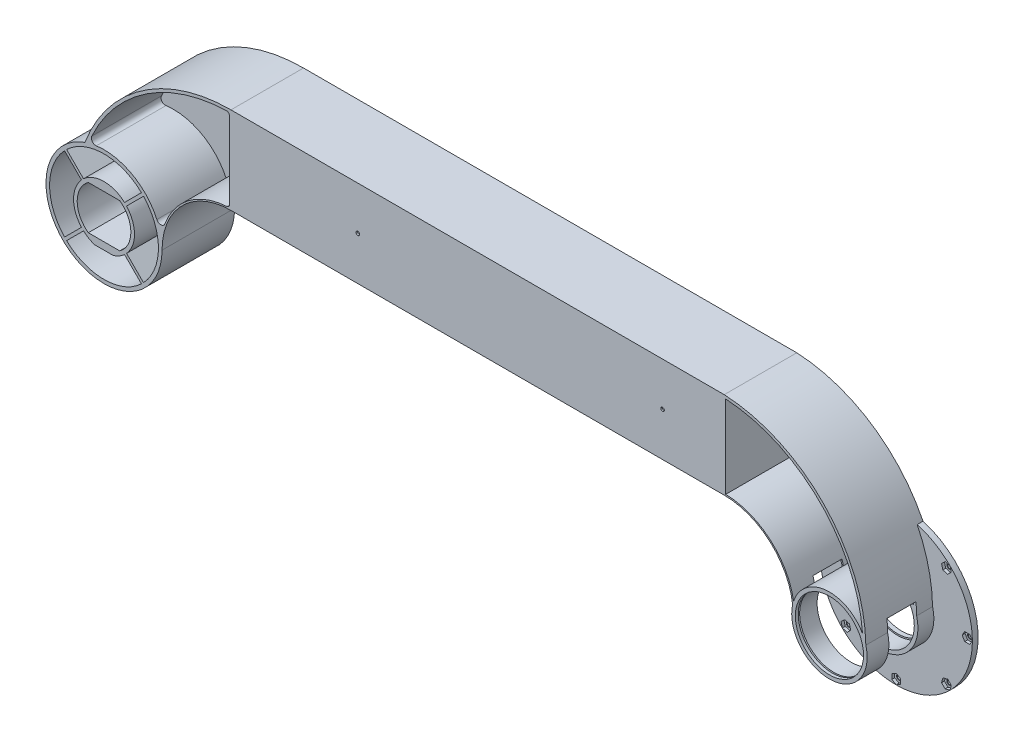
from build123d import *
from build123d.topology import SkipClean

# Parameters (mm, degrees)
BOSS_EXTRUDE1_DEPTH             = 1
BOSS_EXTRUDE2_DEPTH             = 25
SKETCH1_11_R                    = 40
SKETCH1_11_R_2                  = 37.5
SKETCH1_11_R_3                  = 21
BOSS_EXTRUDE3_DEPTH             = 2
SKETCH1_12_R                    = 21
SKETCH1_12_R_2                  = 15
BOSS_EXTRUDE4_DEPTH             = 25
SKETCH1_13_R                    = 40
SKETCH1_13_R_2                  = 37.5
BOSS_EXTRUDE5_DEPTH             = 25
BOSS_EXTRUDE6_START             = -2
SKETCH1_14_R                    = 40
SKETCH1_14_R_2                  = 21
BOSS_EXTRUDE6_DEPTH             = 3
SKETCH1_15_R                    = 23.5
SKETCH1_15_R_2                  = 21
BOSS_EXTRUDE7_DEPTH             = 14
SKETCH1_16_R                    = 40
SKETCH1_16_R_2                  = 23.5
BOSS_EXTRUDE8_DEPTH             = 14
SKETCH1_17_R                    = 37.5
SKETCH1_17_R_2                  = 21
CUT_EXTRUDE1_DEPTH              = 2
SKETCH3_R                       = 31
CUT_EXTRUDE2_DEPTH              = 22
CUT_EXTRUDE4_START              = 1
CUT_EXTRUDE4_DEPTH              = 1
BOSS_EXTRUDE9_START             = 50
BOSS_EXTRUDE9_DEPTH             = 50
BOSS_EXTRUDE10_START            = 50
BOSS_EXTRUDE10_DEPTH            = 50
CUT_EXTRUDE8_DEPTH              = 60
CUT_EXTRUDE8_DEPTH_BACK         = 60
SKETCH6_W                       = 248.929499316
SKETCH6_H                       = 245.601683372
SKETCH7_R                       = 23.5
BOSS_EXTRUDE11_DEPTH            = 50
SKETCH7_23_W                    = 340
SKETCH7_23_H                    = 57
BOSS_EXTRUDE12_DEPTH            = 1
SKETCH10_W                      = 1
SKETCH10_H                      = 57
BOSS_EXTRUDE13_DEPTH            = 15
BOSS_EXTRUDE14_DEPTH            = 2
CUT_EXTRUDE9_START              = 62
CUT_EXTRUDE9_DEPTH              = 62
BOSS_EXTRUDE15_START            = 2
BOSS_EXTRUDE15_DEPTH            = 2
SKETCH7_27_R                    = 37.5
SKETCH7_27_R_2                  = 21
CUT_EXTRUDE10_DEPTH             = 60
SKETCH7_28_R                    = 37.5
SKETCH7_28_R_2                  = 21
BOSS_EXTRUDE16_DEPTH            = 2
FILLET7_R                       = 3
FILLET8_R                       = 2
RIB2_START                      = -48
RIB2_DEPTH                      = 48
SKETCH16_R                      = 5
CUT_EXTRUDE12_DEPTH             = 10
SKETCH17_R                      = 52.5
SKETCH17_R_2                    = 22.5
BOSS_EXTRUDE17_DEPTH            = 4
SKETCH24_R                      = 26
SKETCH24_R_2                    = 23.5
BOSS_EXTRUDE18_DEPTH            = 50
F_3_0MM_DOWEL_HOLE2_D           = 3
F_3_0MM_DOWEL_HOLE2_CSINK_D     = 3.05
F_3_0MM_DOWEL_HOLE2_CSINK_ANGLE = 90
CUT_EXTRUDE13_DEPTH             = 50
CUT_EXTRUDE11_DEPTH             = 15
CUT_EXTRUDE11_DEPTH_BACK        = 40
SKETCH11_W                      = 120
SKETCH11_H                      = 20
SKETCH25_R                      = 25
CUT_EXTRUDE14_DEPTH             = 1
SKETCH30_W                      = 25.987538792
SKETCH30_H                      = 46.839615916
CUT_EXTRUDE17_DEPTH             = 10
CUT_EXTRUDE18_DEPTH             = 2
F_2_5MM_DOWEL_HOLE1_D           = 2.5
F_2_5MM_DOWEL_HOLE1_CSINK_D     = 2.55
F_2_5MM_DOWEL_HOLE1_CSINK_ANGLE = 90
SKETCH40_R                      = 23.5
SKETCH40_R_2                    = 22.5
CUT_EXTRUDE19_DEPTH             = 1
CHAMFER1_SIZE                   = 0.25
CHAMFER2_SIZE                   = 0.25


# Read off the part's stored shape, not the designer's step: Rib2
with BuildPart() as part:
    # Sketch1 → Boss-Extrude1 (new body)
    with BuildSketch(Plane.XY):
        with BuildLine():
            ThreePointArc((87.5, 105.5), (28.068160961, 87.167118275), (-10.708571429, 38.539933808))
            ThreePointArc((-10.708571429, 38.539933808), (21.483664092, 33.740956969), (39.451428571, 6.601877284))
            ThreePointArc((39.451428571, 6.601877284), (55.624782732, 36.554350277), (87.5, 48.5))
            Line((87.5, 48.5), (412.5, 48.5))
            ThreePointArc((412.5, 48.5), (444.375217268, 36.554350277), (460.548571429, 6.601877284))
            ThreePointArc((460.548571429, 6.601877284), (478.516335908, 33.740956969), (510.708571429, 38.539933808))
            ThreePointArc((510.708571429, 38.539933808), (471.931839039, 87.167118275), (412.5, 105.5))
            Line((412.5, 105.5), (87.5, 105.5))
        make_face()
        with BuildLine():
            ThreePointArc((39.451428571, 6.601877284), (39.862621231, 3.312314685), (40, 0))
            ThreePointArc((40, 0), (53.912427894, 33.587572106), (87.5, 47.5))
            Line((87.5, 47.5), (412.5, 47.5))
            ThreePointArc((412.5, 47.5), (446.087572106, 33.587572106), (460, 0))
            ThreePointArc((460, 0), (460.137378769, 3.312314685), (460.548571429, 6.601877284))
            ThreePointArc((460.548571429, 6.601877284), (444.375217268, 36.554350277), (412.5, 48.5))
            Line((412.5, 48.5), (87.5, 48.5))
            ThreePointArc((87.5, 48.5), (55.624782732, 36.554350277), (39.451428571, 6.601877284))
        make_face()
    boss_extrude1 = extrude(amount=BOSS_EXTRUDE1_DEPTH)

    # Sketch1<10> → Boss-Extrude2 (add)
    with BuildSketch(Plane.XY):
        with BuildLine():
            Line((412.5, 107.5), (87.5, 107.5))
            ThreePointArc((87.5, 107.5), (26.283214045, 88.367160854), (-13.142857143, 37.779164974))
            ThreePointArc((-13.142857143, 37.779164974), (-11.931779144, 38.178955545), (-10.708571429, 38.539933808))
            ThreePointArc((-10.708571429, 38.539933808), (28.068160961, 87.167118275), (87.5, 105.5))
            Line((87.5, 105.5), (412.5, 105.5))
            ThreePointArc((412.5, 105.5), (471.931839039, 87.167118275), (510.708571429, 38.539933808))
            ThreePointArc((510.708571429, 38.539933808), (511.931779144, 38.178955545), (513.142857143, 37.779164974))
            ThreePointArc((513.142857143, 37.779164974), (473.716785955, 88.367160854), (412.5, 107.5))
        make_face()
        with BuildLine():
            ThreePointArc((39.451428571, 6.601877284), (39.862621231, 3.312314685), (40, 0))
            ThreePointArc((40, 0), (53.912427894, 33.587572106), (87.5, 47.5))
            Line((87.5, 47.5), (412.5, 47.5))
            ThreePointArc((412.5, 47.5), (446.087572106, 33.587572106), (460, 0))
            ThreePointArc((460, 0), (460.137378769, 3.312314685), (460.548571429, 6.601877284))
            ThreePointArc((460.548571429, 6.601877284), (444.375217268, 36.554350277), (412.5, 48.5))
            Line((412.5, 48.5), (87.5, 48.5))
            ThreePointArc((87.5, 48.5), (55.624782732, 36.554350277), (39.451428571, 6.601877284))
        make_face()
    boss_extrude2 = extrude(amount=BOSS_EXTRUDE2_DEPTH)

    # Sketch1<11> → Boss-Extrude3 (add)
    # profile 1 of 2: a face of its own
    with BuildSketch(Plane.XY):
        Circle(SKETCH1_11_R)
        Circle(SKETCH1_11_R_2, mode=Mode.SUBTRACT)
    # profile 2 of 2: a face of its own
    with BuildSketch(Plane.XY):
        Circle(SKETCH1_11_R_2)
        Circle(SKETCH1_11_R_3, mode=Mode.SUBTRACT)
    boss_extrude3 = extrude(amount=BOSS_EXTRUDE3_DEPTH)

    # Sketch1<12> → Boss-Extrude4 (add)
    with BuildSketch(Plane.XY):
        Circle(SKETCH1_12_R)
        Circle(SKETCH1_12_R_2, mode=Mode.SUBTRACT)
    boss_extrude4 = extrude(amount=BOSS_EXTRUDE4_DEPTH)

    # Sketch1<13> → Boss-Extrude5 (add)
    with BuildSketch(Plane.XY):
        Circle(SKETCH1_13_R)
        Circle(SKETCH1_13_R_2, mode=Mode.SUBTRACT)
    boss_extrude5 = extrude(amount=BOSS_EXTRUDE5_DEPTH)

    # Sketch1<14> → Boss-Extrude6 (add)
    with BuildSketch(Plane.XY.offset(BOSS_EXTRUDE6_START)):
        with Locations((500, 0)):
            Circle(SKETCH1_14_R)
        with Locations((500, 0)):
            Circle(SKETCH1_14_R_2, mode=Mode.SUBTRACT)
    boss_extrude6 = extrude(amount=BOSS_EXTRUDE6_DEPTH)

    # Sketch1<15> → Boss-Extrude7 (add)
    with BuildSketch(Plane.XY):
        with Locations((500, 0)):
            Circle(SKETCH1_15_R)
        with Locations((500, 0)):
            Circle(SKETCH1_15_R_2, mode=Mode.SUBTRACT)
    boss_extrude7 = extrude(amount=BOSS_EXTRUDE7_DEPTH)

    # Sketch1<16> → Boss-Extrude8 (add)
    with BuildSketch(Plane.XY):
        with Locations((500, 0)):
            Circle(SKETCH1_16_R)
        with Locations((500, 0)):
            Circle(SKETCH1_16_R_2, mode=Mode.SUBTRACT)
    boss_extrude8 = extrude(amount=BOSS_EXTRUDE8_DEPTH)

    # Mirror1: Boss-Extrude2, Boss-Extrude3, Boss-Extrude4, Boss-Extrude5, Boss-Extrude6, Boss-Extrude7, Boss-Extrude8 across plane
    add(boss_extrude2.mirror(Plane.XY.offset(25)))
    add(boss_extrude3.mirror(Plane.XY.offset(25)))
    add(boss_extrude4.mirror(Plane.XY.offset(25)))
    add(boss_extrude5.mirror(Plane.XY.offset(25)))
    add(boss_extrude6.mirror(Plane.XY.offset(25)))
    add(boss_extrude7.mirror(Plane.XY.offset(25)))
    add(boss_extrude8.mirror(Plane.XY.offset(25)))

    # Mirror2: Boss-Extrude1 across plane
    add(boss_extrude1.mirror(Plane.XY.offset(25)))

    # Sketch1<17> → Cut-Extrude1 (cut)
    with BuildSketch(Plane.XY):
        with Locations(Location((0, 0, 0), (0, 0, 180))):
            Circle(SKETCH1_17_R)
        with Locations(Location((0, 0, 0), (0, 0, 180))):
            Circle(SKETCH1_17_R_2, mode=Mode.SUBTRACT)
    extrude(amount=CUT_EXTRUDE1_DEPTH, mode=Mode.SUBTRACT)

    # Sketch3 → Cut-Extrude2 (cut)
    with BuildSketch(Plane.XY):
        with Locations((500, 0)):
            Circle(SKETCH3_R)
    extrude(amount=CUT_EXTRUDE2_DEPTH, mode=Mode.SUBTRACT)

    # Sketch5 → Cut-Extrude4 (cut)
    with BuildSketch(Plane.XY.offset(CUT_EXTRUDE4_START)):
        with BuildLine():
            ThreePointArc((510.708571429, 38.539933808), (472.344290507, 86.884468657), (413.5, 105.495260557))
            Line((413.5, 105.495260557), (413.5, 48.489689626))
            ThreePointArc((413.5, 48.489689626), (444.750392176, 36.223779545), (460.548571429, 6.601877284))
            ThreePointArc((460.548571429, 6.601877284), (478.516335908, 33.740956969), (510.708571429, 38.539933808))
        make_face()
        with BuildLine():
            ThreePointArc((86.5, 105.495260557), (27.655709493, 86.884468657), (-10.708571429, 38.539933808))
            ThreePointArc((-10.708571429, 38.539933808), (21.483664092, 33.740956969), (39.451428571, 6.601877284))
            ThreePointArc((39.451428571, 6.601877284), (55.249607824, 36.223779545), (86.5, 48.489689626))
            Line((86.5, 48.489689626), (86.5, 105.495260557))
        make_face()
    extrude(amount=-CUT_EXTRUDE4_DEPTH, mode=Mode.SUBTRACT)

    # Sketch5<19> → Boss-Extrude9 (add)
    with BuildSketch(Plane.XY.offset(BOSS_EXTRUDE9_START)):
        with BuildLine():
            Line((87.5, 48.5), (87.5, 105.5))
            ThreePointArc((87.5, 105.5), (86.999994384, 105.498815133), (86.5, 105.495260557))
            Line((86.5, 105.495260557), (86.5, 48.489689626))
            ThreePointArc((86.5, 48.489689626), (86.999973425, 48.497422338), (87.5, 48.5))
        make_face()
        with BuildLine():
            ThreePointArc((413.5, 105.495260557), (413.000005616, 105.498815133), (412.5, 105.5))
            Line((412.5, 105.5), (412.5, 48.5))
            ThreePointArc((412.5, 48.5), (413.000026575, 48.497422338), (413.5, 48.489689626))
            Line((413.5, 48.489689626), (413.5, 105.495260557))
        make_face()
    extrude(amount=-BOSS_EXTRUDE9_DEPTH)

    # Sketch1<18> → Boss-Extrude10 (add)
    with BuildSketch(Plane.XY.offset(BOSS_EXTRUDE10_START)):
        with BuildLine():
            Line((-7.483314774, 13), (0, 13))
            Line((0, 13), (7.483314774, 13))
            ThreePointArc((7.483314774, 13), (0, 15), (-7.483314774, 13))
        make_face()
        with BuildLine():
            Line((0, -13), (-7.483314774, -13))
            ThreePointArc((-7.483314774, -13), (0, -15), (7.483314774, -13))
            Line((7.483314774, -13), (0, -13))
        make_face()
    extrude(amount=-BOSS_EXTRUDE10_DEPTH)

    # Sketch6 → Cut-Extrude8 (cut, two sides: drawn at the far end of the back side and taken through both)
    with BuildSketch(Plane.XY.offset(-CUT_EXTRUDE8_DEPTH_BACK)):
        with Locations((536.964749658, 15.651167598)):
            Rectangle(SKETCH6_W, SKETCH6_H)
    extrude(amount=CUT_EXTRUDE8_DEPTH + CUT_EXTRUDE8_DEPTH_BACK, mode=Mode.SUBTRACT)

    # Sketch7 → Boss-Extrude11 (add)
    with BuildSketch(Plane.XY):
        with BuildLine():
            Line((427.5, 107.5), (412.5, 107.5))
            Line((412.5, 107.5), (412.5, 105.5))
            Line((412.5, 105.5), (427.5, 105.5))
            Line((427.5, 105.5), (427.5, 48.5))
            Line((427.5, 48.5), (412.5, 48.5))
            Line((412.5, 48.5), (412.5, 47.5))
            Line((412.5, 47.5), (427.5, 47.5))
            ThreePointArc((427.5, 47.5), (461.087572106, 33.587572106), (475, 0))
            ThreePointArc((475, 0), (500, -25), (525, 0))
            ThreePointArc((525, 0), (498.513978978, 73.942911166), (427.5, 107.5))
        make_face()
        with BuildLine():
            ThreePointArc((523.011089442, 9.771886344), (497.865985258, 24.908753102), (475.662068966, 5.715340144))
            ThreePointArc((475.662068966, 5.715340144), (460.082794534, 35.925081772), (428.5, 48.489689626))
            Line((428.5, 48.489689626), (428.5, 105.445258723))
            ThreePointArc((428.5, 105.445258723), (494.085624179, 75.715969985), (523.011089442, 9.771886344))
        make_face(mode=Mode.SUBTRACT)
        with Locations((500, 0)):
            Circle(SKETCH7_R, mode=Mode.SUBTRACT)
    extrude(amount=BOSS_EXTRUDE11_DEPTH)

    # Sketch7<23> → Boss-Extrude12 (add)
    with BuildSketch(Plane.XY):
        with Locations((257.5, 77)):
            Rectangle(SKETCH7_23_W, SKETCH7_23_H)
        with BuildLine():
            Line((428.5, 48.489689626), (428.5, 105.445258723))
            ThreePointArc((428.5, 105.445258723), (428.000068104, 105.473873474), (427.5, 105.5))
            Line((427.5, 105.5), (427.5, 48.5))
            ThreePointArc((427.5, 48.5), (428.000026575, 48.497422338), (428.5, 48.489689626))
        make_face()
    extrude(amount=BOSS_EXTRUDE12_DEPTH)

    # Sketch10 → Boss-Extrude13 (add)
    with BuildSketch(Plane(origin=(412.5, 0, 0), x_dir=(0, 0, -1), z_dir=(1, 0, 0))):
        with Locations((-49.5, 77)):
            Rectangle(SKETCH10_W, SKETCH10_H)
    extrude(amount=BOSS_EXTRUDE13_DEPTH)

    # Sketch7<24> → Boss-Extrude14 (add)
    with BuildSketch(Plane.XY):
        with BuildLine():
            ThreePointArc((475.662068966, 5.715340144), (497.865985258, 24.908753102), (523.011089442, 9.771886344))
            ThreePointArc((523.011089442, 9.771886344), (494.085624179, 75.715969985), (428.5, 105.445258723))
            Line((428.5, 105.445258723), (428.5, 48.489689626))
            ThreePointArc((428.5, 48.489689626), (460.082794534, 35.925081772), (475.662068966, 5.715340144))
        make_face()
    extrude(amount=BOSS_EXTRUDE14_DEPTH)

    # Sketch7<25> → Cut-Extrude9 (cut)
    with BuildSketch(Plane.XY.offset(CUT_EXTRUDE9_START)):
        with BuildLine():
            ThreePointArc((86.5, 105.495260557), (27.655709493, 86.884468657), (-10.708571429, 38.539933808))
            ThreePointArc((-10.708571429, 38.539933808), (21.483664092, 33.740956969), (39.451428571, 6.601877284))
            ThreePointArc((39.451428571, 6.601877284), (55.249607824, 36.223779545), (86.5, 48.489689626))
            Line((86.5, 48.489689626), (86.5, 105.495260557))
        make_face()
    extrude(amount=-CUT_EXTRUDE9_DEPTH, mode=Mode.SUBTRACT)

    # Sketch7<26> → Boss-Extrude15 (add)
    with BuildSketch(Plane.XY.offset(BOSS_EXTRUDE15_START)):
        with BuildLine():
            ThreePointArc((86.5, 105.495260557), (27.655709493, 86.884468657), (-10.708571429, 38.539933808))
            ThreePointArc((-10.708571429, 38.539933808), (21.483664092, 33.740956969), (39.451428571, 6.601877284))
            ThreePointArc((39.451428571, 6.601877284), (55.249607824, 36.223779545), (86.5, 48.489689626))
            Line((86.5, 48.489689626), (86.5, 105.495260557))
        make_face()
    extrude(amount=-BOSS_EXTRUDE15_DEPTH)

    # Sketch7<27> → Cut-Extrude10 (cut)
    with SkipClean():  # the faces are left unmerged after this step: merging them gives an invalid solid
        with BuildSketch(Plane.XY):
            with Locations(Location((0, 0, 0), (0, 0, 180))):
                Circle(SKETCH7_27_R)
            with Locations(Location((0, 0, 0), (0, 0, 180))):
                Circle(SKETCH7_27_R_2, mode=Mode.SUBTRACT)
        extrude(amount=CUT_EXTRUDE10_DEPTH, mode=Mode.SUBTRACT)
    add(part.part.scale(1), mode=Mode.REPLACE)  # the faces are merged on a copy


with BuildPart() as cut_extrude10_piece_1:
    # of the separate pieces the step leaves, piece 1, a body of its own (cut_extrude10_pieces)
    add(part.part.solids().sort_by_distance((87.5, 107.5, 50))[0])



with BuildPart() as cut_extrude10_piece_2:
    # of the separate pieces the step leaves, piece 2, a body of its own (cut_extrude10_pieces)
    add(part.part.solids().sort_by_distance((-21, 0, 50))[0])


with BuildPart() as cut_extrude10_piece_1_1:
    add(cut_extrude10_piece_1.part)

    add(cut_extrude10_piece_2.part)  # Boss-Extrude16 merges Cut-Extrude10 piece 2
    # Sketch7<28> → Boss-Extrude16 (add)
    with BuildSketch(Plane.XY):
        with Locations(Location((0, 0, 0), (0, 0, 180))):
            Circle(SKETCH7_28_R)
        with Locations(Location((0, 0, 0), (0, 0, 180))):
            Circle(SKETCH7_28_R_2, mode=Mode.SUBTRACT)
    extrude(amount=BOSS_EXTRUDE16_DEPTH)

    # Fillet7
    fillet7_edges = [cut_extrude10_piece_1_1.edges().sort_by_distance(p)[0] for p in [
        (-10.708571429, 38.539933808, 26),
        (39.451428571, 6.601877284, 26),
    ]]
    fillet(fillet7_edges, radius=FILLET7_R)

    # Fillet8
    fillet8_edges = [cut_extrude10_piece_1_1.edges().sort_by_distance(p)[0] for p in [
        (86.5, 48.489689626, 26),
        (86.5, 105.495260557, 26),
    ]]
    fillet(fillet8_edges, radius=FILLET8_R)

    # Rib2 outline → Rib2 (add)
    with BuildSketch(Plane.XY.offset(50).offset(RIB2_START)):
        with BuildLine():
            ThreePointArc((-25.799967746, 27.214181309), (-26.516504294, 26.516504294), (-27.214181309, 25.799967746))
            Line((-27.214181309, 25.799967746), (-15.539503755, 14.125290193))
            ThreePointArc((-15.539503755, 14.125290193), (-14.849242405, 14.849242405), (-14.125290193, 15.539503755))
            Line((-14.125290193, 15.539503755), (-25.799967746, 27.214181309))
        make_face()
        with BuildLine():
            Line((-15.539503755, -14.125290193), (-27.214181309, -25.799967746))
            ThreePointArc((-27.214181309, -25.799967746), (-26.516504294, -26.516504294), (-25.799967746, -27.214181309))
            Line((-25.799967746, -27.214181309), (-14.125290193, -15.539503755))
            ThreePointArc((-14.125290193, -15.539503755), (-14.849242405, -14.849242405), (-15.539503755, -14.125290193))
        make_face()
        with BuildLine():
            ThreePointArc((27.214181309, 25.799967746), (26.516504294, 26.516504294), (25.799967746, 27.214181309))
            Line((25.799967746, 27.214181309), (14.125290193, 15.539503755))
            ThreePointArc((14.125290193, 15.539503755), (14.849242405, 14.849242405), (15.539503755, 14.125290193))
            Line((15.539503755, 14.125290193), (27.214181309, 25.799967746))
        make_face()
        with BuildLine():
            Line((14.125290193, -15.539503755), (25.799967746, -27.214181309))
            ThreePointArc((25.799967746, -27.214181309), (26.516504294, -26.516504294), (27.214181309, -25.799967746))
            Line((27.214181309, -25.799967746), (15.539503755, -14.125290193))
            ThreePointArc((15.539503755, -14.125290193), (14.849242405, -14.849242405), (14.125290193, -15.539503755))
        make_face()
    extrude(amount=RIB2_DEPTH)

    # Sketch15 → Ø3.0mm Dowel Hole1 (revolve, cut)
    with BuildSketch(Plane(origin=(0, -13, 25), x_dir=(0, 0, 1), z_dir=(1, 0, 0))):
        Polygon((0, 0), (0, 35.901290929), (1.5, 35), (1.5, 0.025), (1.525, 0), align=None)
    revolve(axis=Axis((0, -6.65, 25), (0, -1, 0)), mode=Mode.SUBTRACT)

    # Sketch16 → Cut-Extrude12 (cut)
    with BuildSketch(Plane(origin=(0, -43, 0), x_dir=(1, 0, 0), z_dir=(0, 1, 0))):
        with Locations(Location((0, -25, 0), (0, 0, 90))):
            Circle(SKETCH16_R)
    extrude(amount=CUT_EXTRUDE12_DEPTH, mode=Mode.SUBTRACT)

    # Sketch17 → Boss-Extrude17 (add)
    with BuildSketch(Plane(origin=(0, 0, 0), x_dir=(-1, 0, 0), z_dir=(0, 0, -1))):
        with Locations((-500, 0)):
            Circle(SKETCH17_R)
        with Locations((-500, 0)):
            Circle(SKETCH17_R_2, mode=Mode.SUBTRACT)
    extrude(amount=-BOSS_EXTRUDE17_DEPTH)

    # Sketch24 → Boss-Extrude18 (add)
    with BuildSketch(Plane(origin=(0, 0, 0), x_dir=(-1, 0, 0), z_dir=(0, 0, -1))):
        with Locations((-500, 0)):
            Circle(SKETCH24_R)
        with Locations((-500, 0)):
            Circle(SKETCH24_R_2, mode=Mode.SUBTRACT)
    extrude(amount=-BOSS_EXTRUDE18_DEPTH)

    # Ø3.0mm Dowel Hole2 (through all)
    with Locations(Plane(origin=(0, 0, 0), x_dir=(-1, 0, 0), z_dir=(0, 0, -1))):
        with Locations((-500, 49), (-465.351767722, 34.648232278), (-451, 0), (-534.648232278, 34.648232278), (-549, 0), (-534.648232278, -34.648232278), (-500, -49), (-465.351767722, -34.648232278)):
            CounterSinkHole(F_3_0MM_DOWEL_HOLE2_D / 2, F_3_0MM_DOWEL_HOLE2_CSINK_D / 2, counter_sink_angle=F_3_0MM_DOWEL_HOLE2_CSINK_ANGLE)

    # Sketch23 → Cut-Extrude13 (cut)
    with BuildSketch(Plane.XY.offset(50)):
        with BuildLine():
            Line((10.828203914, 15), (0, 15))
            Line((0, 15), (-10.828203914, 15))
            ThreePointArc((-10.828203914, 15), (-18.5, 0), (-10.828203914, -15))
            Line((-10.828203914, -15), (0, -15))
            Line((0, -15), (10.828203914, -15))
            ThreePointArc((10.828203914, -15), (16.470758519, -8.42402005), (18.5, 0))
            ThreePointArc((18.5, 0), (16.470758519, 8.42402005), (10.828203914, 15))
        make_face()
    extrude(amount=-CUT_EXTRUDE13_DEPTH, mode=Mode.SUBTRACT)

    # Sketch11 → Cut-Extrude11 (cut, two sides: drawn at the far end of the back side and taken through both)
    with BuildSketch(Plane(origin=(0, 0, 0), x_dir=(1, 0, 0), z_dir=(0, 1, 0)).offset(-CUT_EXTRUDE11_DEPTH_BACK)):
        with Locations((525.121878759, -25)):
            Rectangle(SKETCH11_W, SKETCH11_H)
    extrude(amount=CUT_EXTRUDE11_DEPTH + CUT_EXTRUDE11_DEPTH_BACK, mode=Mode.SUBTRACT)

    # Sketch25 → Cut-Extrude14 (cut)
    with BuildSketch(Plane.XY.offset(47)):
        with Locations((500, 0)):
            Circle(SKETCH25_R)
    extrude(amount=CUT_EXTRUDE14_DEPTH, mode=Mode.SUBTRACT)

    # Sketch30 → Cut-Extrude17 (cut)
    with BuildSketch(Plane(origin=(0, -20, 0), x_dir=(1, 0, 0), z_dir=(0, 1, 0))):
        with Locations((1.11374876, -26.580192042)):
            Rectangle(SKETCH30_W, SKETCH30_H)
    extrude(amount=-CUT_EXTRUDE17_DEPTH, mode=Mode.SUBTRACT)

    # Sketch33 → Cut-Extrude18 (cut)
    with BuildSketch(Plane(origin=(0, 0, 4), x_dir=(-1, 0, 0), z_dir=(0, 0, -1))):
        Polygon((-497, 47.267949192), (-497, 50.732050808), (-500, 52.464101615), (-503, 50.732050808), (-503, 47.267949192), (-500, 45.535898385), align=None)
        Polygon((-531.302167063, 35.54480775), (-533.751656806, 37.994297493), (-537.097722021, 37.097722021), (-537.994297493, 33.751656806), (-535.54480775, 31.302167063), (-532.198742535, 32.198742535), align=None)
        Polygon((-547.267949192, 3), (-550.732050808, 3), (-552.464101615, 0), (-550.732050808, -3), (-547.267949192, -3), (-545.535898385, 0), align=None)
        Polygon((-464.45519225, 31.302167063), (-462.005702507, 33.751656806), (-462.902277979, 37.097722021), (-466.248343194, 37.994297493), (-468.697832937, 35.54480775), (-467.801257465, 32.198742535), align=None)
        Polygon((-452.732050808, -3), (-449.267949192, -3), (-447.535898385, 0), (-449.267949192, 3), (-452.732050808, 3), (-454.464101615, 0), align=None)
        Polygon((-468.697832937, -35.54480775), (-466.248343194, -37.994297493), (-462.902277979, -37.097722021), (-462.005702507, -33.751656806), (-464.45519225, -31.302167063), (-467.801257465, -32.198742535), align=None)
        Polygon((-503, -47.267949192), (-503, -50.732050808), (-500, -52.464101615), (-497, -50.732050808), (-497, -47.267949192), (-500, -45.535898385), align=None)
        Polygon((-535.54480775, -31.302167063), (-537.994297493, -33.751656806), (-537.097722021, -37.097722021), (-533.751656806, -37.994297493), (-531.302167063, -35.54480775), (-532.198742535, -32.198742535), align=None)
    extrude(amount=CUT_EXTRUDE18_DEPTH, mode=Mode.SUBTRACT)

    # Ø2.5mm Dowel Hole1 (through all)
    with Locations(Plane(origin=(0, 0, 0), x_dir=(-1, 0, 0), z_dir=(0, 0, -1))):
        with Locations((-385, 77.5), (-175, 77.5)):
            CounterSinkHole(F_2_5MM_DOWEL_HOLE1_D / 2, F_2_5MM_DOWEL_HOLE1_CSINK_D / 2, counter_sink_angle=F_2_5MM_DOWEL_HOLE1_CSINK_ANGLE)

    # Sketch40 → Cut-Extrude19 (cut)
    with BuildSketch(Plane.XY.offset(4)):
        with Locations((500, 0)):
            Circle(SKETCH40_R)
        with Locations(Location((500, 0, 0), (0, 0, 180))):
            Circle(SKETCH40_R_2, mode=Mode.SUBTRACT)
    extrude(amount=-CUT_EXTRUDE19_DEPTH, mode=Mode.SUBTRACT)

    # Chamfer1
    chamfer1_edges = [cut_extrude10_piece_1_1.edges().sort_by_distance(p)[0] for p in [
        (498.5, 49, 2),
        (533.148232278, 34.648232278, 2),
        (547.5, 0, 2),
        (463.851767722, 34.648232278, 2),
        (449.5, 0, 2),
        (463.851767722, -34.648232278, 2),
        (498.5, -49, 2),
        (533.148232278, -34.648232278, 2),
    ]]
    chamfer(chamfer1_edges, length=CHAMFER1_SIZE)

    # Chamfer2
    chamfer2_edges = [cut_extrude10_piece_1_1.edges().sort_by_distance(p)[0] for p in [
        (0, -20, 23.5),
    ]]
    chamfer(chamfer2_edges, length=CHAMFER2_SIZE)


solid = cut_extrude10_piece_1_1.part
